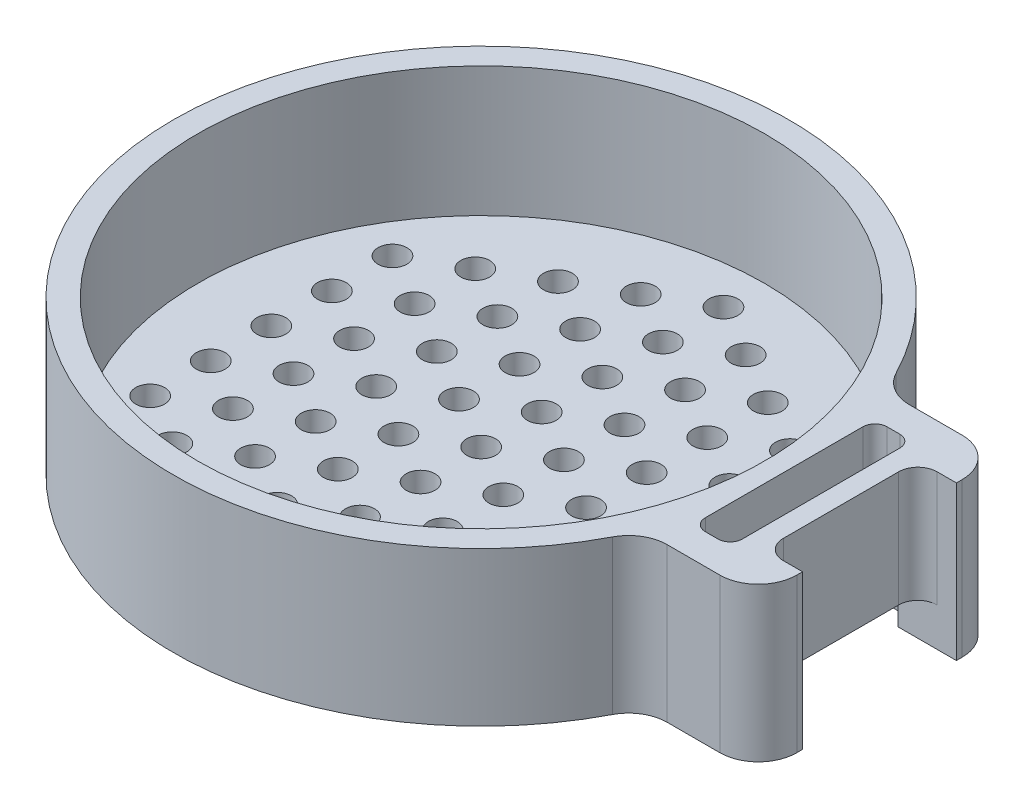
from build123d import *

# Parameters (mm, degrees)
BOSS_EXTRUDE1_DEPTH      = 6.35
BOSS_EXTRUDE1_DEPTH_BACK = 6.35
SKETCH2_R                = 25.4
SHELL1_T                 = -2
BOSS_EXTRUDE2_DEPTH      = 6.35
BOSS_EXTRUDE2_DEPTH_BACK = 6.35
CUT_EXTRUDE1_DEPTH       = 44.444866103
SKETCH10_W               = 3.18
SKETCH10_H               = 12.7
CUT_EXTRUDE2_DEPTH       = 44.444866103
FILLET1_R                = 3.175
CUT_EXTRUDE4_REACH       = 63.003
SKETCH11_W               = 12.7
SKETCH11_H               = 3.18
FILLET2_R                = 1.5875
FILL_START               = -6.35
FILL_PATTERN1_OUTLINE_R  = 1.190625
FILL_PATTERN1_DEPTH      = 2


# Read off the part's stored shape, not the designer's step: Fill Pattern1
with BuildPart() as part:
    # Sketch2 → Boss-Extrude1 (new, two sides: drawn at the far end of the back side and taken through both)
    with BuildSketch(Plane(origin=(0, 0, 0), x_dir=(1, 0, 0), z_dir=(0, 1, 0)).offset(-BOSS_EXTRUDE1_DEPTH_BACK)):
        with Locations(Location((0, 0, 0), (0, 0, 270))):
            Circle(SKETCH2_R)
    extrude(amount=BOSS_EXTRUDE1_DEPTH + BOSS_EXTRUDE1_DEPTH_BACK)

    # Shell1
    shell1_openings = [part.faces().sort_by_distance(p)[0] for p in [
        (0, 6.35, 0),
    ]]
    offset(amount=SHELL1_T, openings=shell1_openings, kind=Kind.INTERSECTION)

    # Sketch7 → Boss-Extrude2 (add, two sides: drawn at the far end of the back side and taken through both)
    with BuildSketch(Plane(origin=(0, 0, 0), x_dir=(1, 0, 0), z_dir=(0, 1, 0)).offset(-BOSS_EXTRUDE2_DEPTH_BACK)):
        with BuildLine():
            Line((23.348661632, 10), (32.878661632, 10))
            Line((32.878661632, 10), (32.878661632, -10))
            Line((32.878661632, -10), (23.348661632, -10))
            ThreePointArc((23.348661632, -10), (25.4, 0), (23.348661632, 10))
        make_face()
    extrude(amount=BOSS_EXTRUDE2_DEPTH + BOSS_EXTRUDE2_DEPTH_BACK)

    # Sketch9 → Cut-Extrude1 (cut, through all)
    with BuildSketch(Plane(origin=(0, 6.35, 0), x_dir=(1, 0, 0), z_dir=(0, 1, 0))):
        with BuildLine():
            Line((26.003661632, 7.5), (27.053661632, 7.5))
            ThreePointArc((27.053661632, 7.5), (27.760768413, 7.207106781), (28.053661632, 6.5))
            Line((28.053661632, 6.5), (28.053661632, -6.5))
            ThreePointArc((28.053661632, -6.5), (27.760768413, -7.207106781), (27.053661632, -7.5))
            Line((27.053661632, -7.5), (26.003661632, -7.5))
            ThreePointArc((26.003661632, -7.5), (25.296554851, -7.207106781), (25.003661632, -6.5))
            Line((25.003661632, -6.5), (25.003661632, 6.5))
            ThreePointArc((25.003661632, 6.5), (25.296554851, 7.207106781), (26.003661632, 7.5))
        make_face()
    extrude(amount=-CUT_EXTRUDE1_DEPTH, mode=Mode.SUBTRACT)

    # Sketch10 → Cut-Extrude2 (cut, through all)
    with BuildSketch(Plane(origin=(0, 6.35, 0), x_dir=(1, 0, 0), z_dir=(0, 1, 0))):
        with Locations((31.288661632, 0)):
            Rectangle(SKETCH10_W, SKETCH10_H)
    extrude(amount=-CUT_EXTRUDE2_DEPTH, mode=Mode.SUBTRACT)

    # Fillet1
    fillet1_edges = [part.edges().sort_by_distance(p)[0] for p in [
        (23.348661632, 0, 10),
        (23.348661632, 0, -10),
        (32.878661632, 0, -10),
        (32.878661632, 0, 10),
    ]]
    fillet(fillet1_edges, radius=FILLET1_R)

    # Sketch11 → Cut-Extrude4 (cut, up to next)
    with BuildSketch(Plane(origin=(29.698661632, 0, 0), x_dir=(0, 0, -1), z_dir=(1, 0, 0)), mode=Mode.PRIVATE) as cut_extrude4_sk1:
        with Locations((0, -4.76)):
            Rectangle(SKETCH11_W, SKETCH11_H)
    cut_extrude4_tool1 = extrude(cut_extrude4_sk1.sketch, amount=-CUT_EXTRUDE4_REACH, mode=Mode.PRIVATE) & part.part
    add(cut_extrude4_tool1.solids().sort_by_distance((29.698662, -4.76, 0))[0], mode=Mode.SUBTRACT)

    # Fillet2
    fillet2_edges = [part.edges().sort_by_distance(p)[0] for p in [
        (29.698661632, 1.59, -6.35),
        (29.698661632, 1.59, 6.35),
    ]]
    fillet(fillet2_edges, radius=FILLET2_R)

    # Fill Pattern1 outline → Fill Pattern1 (cut)
    with BuildSketch(Plane(origin=(0, 0, 0), x_dir=(1, 0, 0), z_dir=(0, 1, 0)).offset(FILL_START)):
        with Locations((0, -19.999996628)):
            Circle(FILL_PATTERN1_OUTLINE_R)
        with Locations((4.330127019, -12.499996628)):
            Circle(FILL_PATTERN1_OUTLINE_R)
        with Locations((4.330127019, -7.499996628)):
            Circle(FILL_PATTERN1_OUTLINE_R)
        with Locations((8.660254038, -4.999996628)):
            Circle(FILL_PATTERN1_OUTLINE_R)
        with Locations((8.660254038, 3.372e-06)):
            Circle(FILL_PATTERN1_OUTLINE_R)
        with Locations((12.990381057, 2.500003372)):
            Circle(FILL_PATTERN1_OUTLINE_R)
        with Locations((12.990381057, 7.500003372)):
            Circle(FILL_PATTERN1_OUTLINE_R)
        with Locations((8.660254038, 15.000003372)):
            Circle(FILL_PATTERN1_OUTLINE_R)
        with Locations((-12.990381057, -12.499996628)):
            Circle(FILL_PATTERN1_OUTLINE_R)
        with Locations((-4.330127019, -12.499996628)):
            Circle(FILL_PATTERN1_OUTLINE_R)
        with Locations((0, -9.999996628)):
            Circle(FILL_PATTERN1_OUTLINE_R)
        with Locations((0, -4.999996628)):
            Circle(FILL_PATTERN1_OUTLINE_R)
        with Locations((4.330127019, -2.499996628)):
            Circle(FILL_PATTERN1_OUTLINE_R)
        with Locations((4.330127019, 2.500003372)):
            Circle(FILL_PATTERN1_OUTLINE_R)
        with Locations((8.660254038, 5.000003372)):
            Circle(FILL_PATTERN1_OUTLINE_R)
        with Locations((8.660254038, 10.000003372)):
            Circle(FILL_PATTERN1_OUTLINE_R)
        with Locations((17.320508076, 10.000003372)):
            Circle(FILL_PATTERN1_OUTLINE_R)
        with Locations((-4.330127019, -17.499996628)):
            Circle(FILL_PATTERN1_OUTLINE_R)
        with Locations((4.330127019, -17.499996628)):
            Circle(FILL_PATTERN1_OUTLINE_R)
        with Locations((8.660254038, -14.999996628)):
            Circle(FILL_PATTERN1_OUTLINE_R)
        with Locations((17.320508076, -4.999996628)):
            Circle(FILL_PATTERN1_OUTLINE_R)
        with Locations((17.320508076, -9.999996628)):
            Circle(FILL_PATTERN1_OUTLINE_R)
        with Locations((12.990381057, -12.499996628)):
            Circle(FILL_PATTERN1_OUTLINE_R)
        with Locations((0, -14.999996628)):
            Circle(FILL_PATTERN1_OUTLINE_R)
        with Locations((-8.660254038, -14.999996628)):
            Circle(FILL_PATTERN1_OUTLINE_R)
        with Locations((12.990381057, 12.500003372)):
            Circle(FILL_PATTERN1_OUTLINE_R)
        with Locations((17.320508076, 5.000003372)):
            Circle(FILL_PATTERN1_OUTLINE_R)
        with Locations((17.320508076, 3.372e-06)):
            Circle(FILL_PATTERN1_OUTLINE_R)
        with Locations((12.990381057, -2.499996628)):
            Circle(FILL_PATTERN1_OUTLINE_R)
        with Locations((12.990381057, -7.499996628)):
            Circle(FILL_PATTERN1_OUTLINE_R)
        with Locations((8.660254038, -9.999996628)):
            Circle(FILL_PATTERN1_OUTLINE_R)
        with Locations((-8.660254038, 10.000003372)):
            Circle(FILL_PATTERN1_OUTLINE_R)
        with Locations((-8.660254038, 5.000003372)):
            Circle(FILL_PATTERN1_OUTLINE_R)
        with Locations((-12.990381057, 2.500003372)):
            Circle(FILL_PATTERN1_OUTLINE_R)
        with Locations((-12.990381057, -2.499996628)):
            Circle(FILL_PATTERN1_OUTLINE_R)
        with Locations((0, 10.000003372)):
            Circle(FILL_PATTERN1_OUTLINE_R)
        with Locations((0, 15.000003372)):
            Circle(FILL_PATTERN1_OUTLINE_R)
        with Locations((-17.320508076, -4.999996628)):
            Circle(FILL_PATTERN1_OUTLINE_R)
        with Locations((-12.990381057, 7.500003372)):
            Circle(FILL_PATTERN1_OUTLINE_R)
        with Locations((-12.990381057, 12.500003372)):
            Circle(FILL_PATTERN1_OUTLINE_R)
        with Locations((-8.660254038, 15.000003372)):
            Circle(FILL_PATTERN1_OUTLINE_R)
        with Locations((-17.320508076, 10.000003372)):
            Circle(FILL_PATTERN1_OUTLINE_R)
        with Locations((-17.320508076, 5.000003372)):
            Circle(FILL_PATTERN1_OUTLINE_R)
        with Locations((-17.320508076, 3.372e-06)):
            Circle(FILL_PATTERN1_OUTLINE_R)
        with Locations((-4.330127019, 17.500003372)):
            Circle(FILL_PATTERN1_OUTLINE_R)
        with Locations((-4.330127019, 12.500003372)):
            Circle(FILL_PATTERN1_OUTLINE_R)
        with Locations((0, 5.000003372)):
            Circle(FILL_PATTERN1_OUTLINE_R)
        with Locations((0, 3.372e-06)):
            Circle(FILL_PATTERN1_OUTLINE_R)
        with Locations((-4.330127019, -2.499996628)):
            Circle(FILL_PATTERN1_OUTLINE_R)
        with Locations((-4.330127019, -7.499996628)):
            Circle(FILL_PATTERN1_OUTLINE_R)
        with Locations((-8.660254038, -9.999996628)):
            Circle(FILL_PATTERN1_OUTLINE_R)
        with Locations((-17.320508076, -9.999996628)):
            Circle(FILL_PATTERN1_OUTLINE_R)
        with Locations((4.330127019, 17.500003372)):
            Circle(FILL_PATTERN1_OUTLINE_R)
        with Locations((-4.330127019, 7.500003372)):
            Circle(FILL_PATTERN1_OUTLINE_R)
        with Locations((-4.330127019, 2.500003372)):
            Circle(FILL_PATTERN1_OUTLINE_R)
        with Locations((-8.660254038, 3.372e-06)):
            Circle(FILL_PATTERN1_OUTLINE_R)
        with Locations((-8.660254038, -4.999996628)):
            Circle(FILL_PATTERN1_OUTLINE_R)
        with Locations((-12.990381057, -7.499996628)):
            Circle(FILL_PATTERN1_OUTLINE_R)
        with Locations((0, 20.000003372)):
            Circle(FILL_PATTERN1_OUTLINE_R)
        with Locations((4.330127019, 12.500003372)):
            Circle(FILL_PATTERN1_OUTLINE_R)
        with Locations((4.330127019, 7.500003372)):
            Circle(FILL_PATTERN1_OUTLINE_R)
    extrude(amount=FILL_PATTERN1_DEPTH, mode=Mode.SUBTRACT)


solid = part.part
